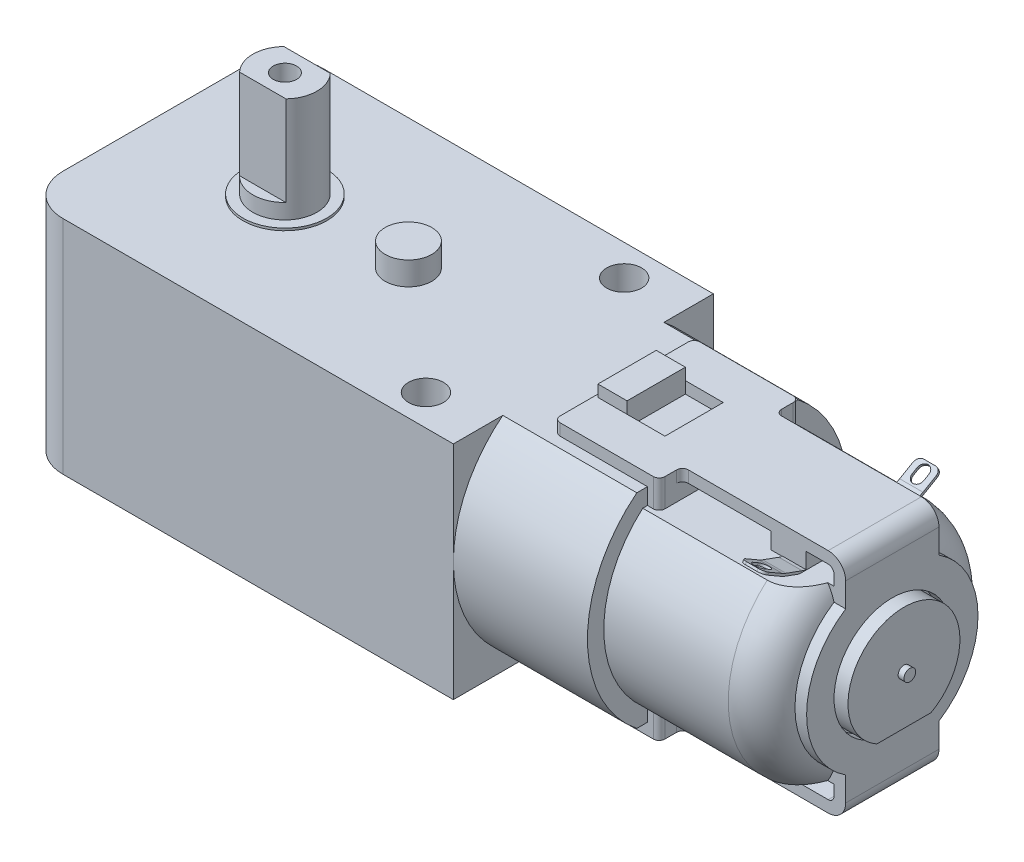
from build123d import *
from build123d.topology import SkipClean

# Parameters (mm, degrees)
SKETCH_1_W             = 37
SKETCH_1_H             = 22.3
EXTRUDE_1_DEPTH        = 9.5
EXTRUDE_2_DEPTH        = 11.5
EXTRUDE_3_DEPTH        = 14
EXTRUDE_4_DEPTH        = 2
SKETCH_5_R             = 0.5
EXTRUDE_5_DEPTH        = 0.5
SKETCH_6_R             = 7.35
SKETCH_6_R_2           = 5
SKETCH_6_W             = 8
SKETCH_6_H             = 3.583761276
EXTRUDE_6_DEPTH        = 1
SKETCH_7_W             = 8
SKETCH_7_H             = 1
EXTRUDE_7_DEPTH        = 23
EXTRUDE_START          = -1
SKETCH_8_W             = 9
SKETCH_8_H             = 2
EXTRUDE_8_DEPTH        = 1
SKETCH_9_W             = 4
SKETCH_9_H             = 5
CUT_EXTRUDE_1_DEPTH    = 1
SKETCH_10_W            = 0.75
SKETCH_10_H            = 1
EXTRUDE_9_DEPTH        = 2.5
SKETCH_11_R            = 1.5
CUT_EXTRUDE_2_DEPTH    = 52.454567339
SKETCH_12_W            = 3
SKETCH_12_H            = 8
EXTRUDE_10_DEPTH       = 1.4
EXTRUDE_12_DEPTH       = 2
SKETCH_14_R            = 2
EXTRUDE_13_DEPTH       = 2
SKETCH_15_R            = 3.6
EXTRUDE_14_DEPTH       = 0.2
EXTRUDE_15_DEPTH       = 9
SKETCH_17_R            = 2.75
EXTRUDE_16_DEPTH       = 1.3
SKETCH_22_R            = 1
CUT_EXTRUDE_5_DEPTH    = 7
SKETCH_18_W            = 5
SKETCH_18_H            = 3
EXTRUDE_17_DEPTH       = 5
SKETCH_19_R            = 1.5
CUT_EXTRUDE_3_DEPTH    = 51.487746038
FILLET_1_R             = 3.5
FILLET_2_R             = 3.5
FILLET_3_R             = 0.5
FILLET_4_R             = 1.5
CUT_EXTRUDE_4_DEPTH    = 51.609625012
FILLET_5_R             = 0.5
MIRROR_START           = -2.5
MIRROR_3_OUTLINE_W     = 3.25
MIRROR_3_OUTLINE_H     = 1
MIRROR_3_DEPTH         = 5
MIRROR_START_2         = -6
MIRROR_3_2_OUTLINE_W   = 1
MIRROR_3_2_OUTLINE_H   = 1.4
MIRROR_3_2_OUTLINE_W_2 = 2.75
MIRROR_3_2_OUTLINE_H_2 = 1
MIRROR_3_2_DEPTH       = 12
MIRROR_3_3_OUTLINE_W   = 2.5
MIRROR_3_3_OUTLINE_H   = 1
MIRROR_3_3_DEPTH       = 5
MIRROR_3_4_OUTLINE_W   = 3.25
MIRROR_3_4_OUTLINE_H   = 1
MIRROR_3_4_DEPTH       = 2
MIRROR_START_3         = 4
MIRROR_3_5_OUTLINE_W   = 3.25
MIRROR_3_5_OUTLINE_H   = 1
MIRROR_3_5_DEPTH       = 2
FILLET_6_R             = 1
FILLET_7_R             = 0.5


with BuildPart() as part:
    # 草图1 → 凸台-拉伸1 (new, symmetric)
    with BuildSketch(Plane(origin=(0, 0, 0), x_dir=(1, 0, 0), z_dir=(0, 1, 0))):
        Rectangle(SKETCH_1_W, SKETCH_1_H)
    extrude(amount=EXTRUDE_1_DEPTH, both=True)

    # 草图2 → 凸台-拉伸2 (add)
    with BuildSketch(Plane(origin=(18.5, 0, 0), x_dir=(0, 0, -1), z_dir=(1, 0, 0))):
        with BuildLine():
            Line((-6.910861017, -8), (6.910861017, -8))
            ThreePointArc((6.910861017, -8), (11.15, 0.75), (6.910861017, 9.5))
            Line((6.910861017, 9.5), (-6.910861017, 9.5))
            ThreePointArc((-6.910861017, 9.5), (-11.15, 0.75), (-6.910861017, -8))
        make_face()
    extrude(amount=EXTRUDE_2_DEPTH)

    # 草图3 → 凸台-拉伸3 (add)
    with BuildSketch(Plane(origin=(30, 0, 0), x_dir=(0, 0, -1), z_dir=(1, 0, 0))):
        with BuildLine():
            Line((6.406246951, 8.1), (-6.406246951, 8.1))
            ThreePointArc((-6.406246951, 8.1), (-9.75, 0.75), (-6.406246951, -6.6))
            Line((-6.406246951, -6.6), (6.406246951, -6.6))
            ThreePointArc((6.406246951, -6.6), (9.75, 0.75), (6.406246951, 8.1))
        make_face()
    extrude(amount=EXTRUDE_3_DEPTH)

    # 草图4 → 凸台-拉伸4 (add)
    with BuildSketch(Plane(origin=(44, 0, 0), x_dir=(0, 0, -1), z_dir=(1, 0, 0))):
        with BuildLine():
            Line((-2.323790008, -3.45), (2.323790008, -3.45))
            ThreePointArc((2.323790008, -3.45), (0, 5.55), (-2.323790008, -3.45))
        make_face()
    extrude(amount=EXTRUDE_4_DEPTH)

    # 草图5 → 凸台-拉伸5 (add)
    with BuildSketch(Plane(origin=(46, 0, 0), x_dir=(0, 0, -1), z_dir=(1, 0, 0))):
        with Locations((0, 0.75)):
            Circle(SKETCH_5_R)
    extrude(amount=EXTRUDE_5_DEPTH)

    # 草图6 → 凸台-拉伸6 (add)
    # profile 1 of 3: a face of its own
    with BuildSketch(Plane(origin=(44, 0, 0), x_dir=(0, 0, -1), z_dir=(1, 0, 0))):
        with Locations((0, 0.75)):
            Circle(SKETCH_6_R)
        with Locations((0, 0.75)):
            Circle(SKETCH_6_R_2, mode=Mode.SUBTRACT)
    # profile 2 of 3: a face of its own
    with BuildSketch(Plane(origin=(44, 0, 0), x_dir=(0, 0, -1), z_dir=(1, 0, 0))):
        with Locations((0, 8.708119362)):
            Rectangle(SKETCH_6_W, SKETCH_6_H)
    # profile 3 of 3: a face of its own
    with BuildSketch(Plane(origin=(44, 0, 0), x_dir=(0, 0, -1), z_dir=(1, 0, 0))):
        with Locations((0, -7.208119362)):
            Rectangle(SKETCH_6_W, SKETCH_6_H)
    extrude(amount=EXTRUDE_6_DEPTH)

    # 草图7 → 凸台-拉伸7 (add)
    with BuildSketch(Plane(origin=(45, 0, 0), x_dir=(0, 0, -1), z_dir=(1, 0, 0))):
        with Locations((0, 10)):
            Rectangle(SKETCH_7_W, SKETCH_7_H)
        with Locations((0, -8.5)):
            Rectangle(SKETCH_7_W, SKETCH_7_H)
    extrude(amount=-EXTRUDE_7_DEPTH)

    # 草图8 → 凸台-拉伸8 (add)
    with BuildSketch(Plane(origin=(0, 10.5, 0), x_dir=(1, 0, 0), z_dir=(0, 1, 0)).offset(EXTRUDE_START)):
        with Locations((26.5, -5)):
            Rectangle(SKETCH_8_W, SKETCH_8_H)
        with Locations((26.5, 5)):
            Rectangle(SKETCH_8_W, SKETCH_8_H)
    extrude(amount=EXTRUDE_8_DEPTH)

    # 草图9 → 切除-拉伸1 (cut)
    with BuildSketch(Plane(origin=(0, 10.5, 0), x_dir=(1, 0, 0), z_dir=(0, 1, 0))):
        with Locations((26, 0)):
            Rectangle(SKETCH_9_W, SKETCH_9_H)
    extrude(amount=-CUT_EXTRUDE_1_DEPTH, mode=Mode.SUBTRACT)

    # 草图10 → 凸台-拉伸9 (add, symmetric)
    with BuildSketch(Plane.XY):
        Polygon((24.75, 11.5), (22.25, 11.5), (22.25, 10.5), (24, 10.5), (24.75, 10.5), align=None)
        with Locations((24.375, 10)):
            Rectangle(SKETCH_10_W, SKETCH_10_H)
    extrude(amount=EXTRUDE_9_DEPTH, both=True)

    # 草图11 → 切除-拉伸2 (cut, through all)
    with BuildSketch(Plane(origin=(0, 9.5, 0), x_dir=(1, 0, 0), z_dir=(0, 1, 0))):
        with Locations(Location((13.5, 8.5, 0), (0, 0, 270))):
            Circle(SKETCH_11_R)
        with Locations(Location((13.5, -8.5, 0), (0, 0, 90))):
            Circle(SKETCH_11_R)
    extrude(amount=-CUT_EXTRUDE_2_DEPTH, mode=Mode.SUBTRACT)

    # 草图12 → 凸台-拉伸10 (add)
    with BuildSketch(Plane(origin=(0, 8.1, 0), x_dir=(1, 0, 0), z_dir=(0, 1, 0))):
        with Locations((40.1, 0)):
            Rectangle(SKETCH_12_W, SKETCH_12_H)
    extrude(amount=EXTRUDE_10_DEPTH)

    # 草图13 → 凸台-拉伸12 (add)
    with BuildSketch(Plane(origin=(41.6, 0, 0), x_dir=(0, 0, -1), z_dir=(1, 0, 0))):
        with BuildLine():
            Line((-3.647346039, 8.1), (3.647346039, 8.1))
            ThreePointArc((3.647346039, 8.1), (3.994642394, 8.130384494), (4.331386325, 8.220614758))
            Line((4.331386325, 8.220614758), (5.714960339, 8.724194516))
            ThreePointArc((5.714960339, 8.724194516), (5.876156575, 8.790964184), (6.030920052, 8.87152895))
            Line((6.030920052, 8.87152895), (7.611436049, 9.784040287))
            Line((7.611436049, 9.784040287), (7.711436049, 9.610835206))
            Line((7.711436049, 9.610835206), (6.130920052, 8.698323869))
            ThreePointArc((6.130920052, 8.698323869), (5.960680228, 8.609702626), (5.783364367, 8.536255992))
            Line((5.783364367, 8.536255992), (4.399790354, 8.032676234))
            ThreePointArc((4.399790354, 8.032676234), (4.029372029, 7.933422943), (3.647346039, 7.9))
            Line((3.647346039, 7.9), (-3.647346039, 7.9))
            ThreePointArc((-3.647346039, 7.9), (-4.029372029, 7.933422943), (-4.399790354, 8.032676234))
            Line((-4.399790354, 8.032676234), (-5.783364367, 8.536255992))
            ThreePointArc((-5.783364367, 8.536255992), (-5.960680228, 8.609702626), (-6.130920052, 8.698323869))
            Line((-6.130920052, 8.698323869), (-7.711436049, 9.610835206))
            Line((-7.711436049, 9.610835206), (-7.611436049, 9.784040287))
            Line((-7.611436049, 9.784040287), (-6.030920052, 8.87152895))
            ThreePointArc((-6.030920052, 8.87152895), (-5.876156575, 8.790964184), (-5.714960339, 8.724194516))
            Line((-5.714960339, 8.724194516), (-4.331386325, 8.220614758))
            ThreePointArc((-4.331386325, 8.220614758), (-3.994642394, 8.130384494), (-3.647346039, 8.1))
        make_face()
    extrude(amount=-EXTRUDE_12_DEPTH)

    # 草图14 → 凸台-拉伸13 (add)
    with BuildSketch(Plane(origin=(0, 9.5, 0), x_dir=(1, 0, 0), z_dir=(0, 1, 0))):
        with Locations(Location((3.5, 0, 0), (0, 0, 270))):
            Circle(SKETCH_14_R)
    extrude(amount=EXTRUDE_13_DEPTH)

    # 草图15 → 凸台-拉伸14 (add)
    with BuildSketch(Plane(origin=(0, 9.5, 0), x_dir=(1, 0, 0), z_dir=(0, 1, 0))):
        with Locations(Location((-7.1, 0, 0), (0, 0, 270))):
            Circle(SKETCH_15_R)
    extrude_14 = extrude(amount=EXTRUDE_14_DEPTH)

    # 草图16 → 凸台-拉伸15 (add)
    with BuildSketch(Plane(origin=(0, 9.7, 0), x_dir=(1, 0, 0), z_dir=(0, 1, 0))):
        with BuildLine():
            Line((-9.088089535, 1.9), (-5.111910465, 1.9))
            ThreePointArc((-5.111910465, 1.9), (-4.35, 0), (-5.111910465, -1.9))
            Line((-5.111910465, -1.9), (-9.088089535, -1.9))
            ThreePointArc((-9.088089535, -1.9), (-9.85, 0), (-9.088089535, 1.9))
        make_face()
    extrude_15 = extrude(amount=EXTRUDE_15_DEPTH)

    # 草图17 → 凸台-拉伸16 (add)
    with SkipClean():  # the faces are left unmerged after this step: merging them gives an invalid solid
        with BuildSketch(Plane(origin=(0, 9.7, 0), x_dir=(1, 0, 0), z_dir=(0, 1, 0))):
            with Locations(Location((-7.1, 0, 0), (0, 0, 43.702114437))):
                Circle(SKETCH_17_R)
        extrude_16 = extrude(amount=EXTRUDE_16_DEPTH)

    # 草图22 → 切除-拉伸5 (cut)
    with SkipClean():  # the faces are left unmerged after this step: merging them gives an invalid solid
        with BuildSketch(Plane(origin=(0, 18.7, 0), x_dir=(1, 0, 0), z_dir=(0, 1, 0))):
            with Locations(Location((-7.1, 0, 0), (0, 0, 270))):
                Circle(SKETCH_22_R)
        cut_extrude_5 = extrude(amount=-CUT_EXTRUDE_5_DEPTH, mode=Mode.SUBTRACT)

    # 草图18 → 凸台-拉伸17 (add)
    with SkipClean():  # the faces are left unmerged after this step: merging them gives an invalid solid
        with BuildSketch(Plane.ZY.offset(18.5)):
            with Locations((0, 1)):
                Rectangle(SKETCH_18_W, SKETCH_18_H)
        extrude(amount=EXTRUDE_17_DEPTH)

    # 草图19 → 切除-拉伸3 (cut, through all)
    with SkipClean():  # the faces are left unmerged after this step: merging them gives an invalid solid
        with BuildSketch(Plane(origin=(0, 2.5, 0), x_dir=(1, 0, 0), z_dir=(0, 1, 0))):
            with Locations(Location((-21, 0, 0), (0, 0, 270))):
                Circle(SKETCH_19_R)
        extrude(amount=-CUT_EXTRUDE_3_DEPTH, mode=Mode.SUBTRACT)

    # 圆角1
    fillet_1_edges = [part.edges().sort_by_distance(p)[0] for p in [
        (-18.5, 0, -11.15),
        (-18.5, 0, 11.15),
    ]]
    fillet(fillet_1_edges, radius=FILLET_1_R)

    # 圆角2
    # the kernel refuses this fillet: 3.5 mm, written as the material it takes off along each edge
    with BuildSketch(Plane(origin=(44, 0.75, 0), x_dir=(0, -0.9908385176498127, 0.13505196015431215), z_dir=(0, 0.13505196015431215, 0.9908385176498127))) as fillet_2_piece_1_section:
        with BuildLine():
            CenterArc((6.25, -3.322649545), FILLET_2_R, 0, 71.682301589)
            Line((7.35, 0), (9.75, 0))
            Line((9.75, 0), (9.75, -3.322649545))
        make_face()
    fillet_2_piece_1 = revolve(axis=Axis((44, 0.75, 0), (1, 0, 0)), revolution_arc=195.523249004, mode=Mode.PRIVATE)
    fillet_2_piece_1 = split(fillet_2_piece_1, bisect_by=Plane(origin=(44, 0.75, -4), z_dir=(0, 0, -1)), keep=Keep.TOP, mode=Mode.PRIVATE)
    fillet_2_piece_1 = split(fillet_2_piece_1, bisect_by=Plane(origin=(44, 8.1, 0), z_dir=(0, -1, 0)), keep=Keep.TOP, mode=Mode.PRIVATE)
    add(fillet_2_piece_1, mode=Mode.SUBTRACT)
    with BuildSketch(Plane(origin=(44, 0.75, 0), x_dir=(0, 0.9908385176498129, -0.13505196015431062), z_dir=(0, -0.13505196015431062, -0.9908385176498129))) as fillet_2_piece_2_section:
        with BuildLine():
            CenterArc((6.25, -3.322649545), FILLET_2_R, 0, 71.682301589)
            Line((7.35, 0), (9.75, 0))
            Line((9.75, 0), (9.75, -3.322649545))
        make_face()
    fillet_2_piece_2 = revolve(axis=Axis((44, 0.75, 0), (1, 0, 0)), revolution_arc=195.523249004, mode=Mode.PRIVATE)
    fillet_2_piece_2 = split(fillet_2_piece_2, bisect_by=Plane(origin=(44, 0.75, 4), z_dir=(0, 0, 1)), keep=Keep.TOP, mode=Mode.PRIVATE)
    fillet_2_piece_2 = split(fillet_2_piece_2, bisect_by=Plane(origin=(44, 8.1, 0), z_dir=(0, -1, 0)), keep=Keep.TOP, mode=Mode.PRIVATE)
    add(fillet_2_piece_2, mode=Mode.SUBTRACT)

    # 圆角3
    fillet_3_edges = [part.edges().sort_by_distance(p)[0] for p in [
        (44, 9.5, 0),
        (44, -8, 0),
    ]]
    fillet(fillet_3_edges, radius=FILLET_3_R)

    # 圆角4
    fillet_4_edges = [part.edges().sort_by_distance(p)[0] for p in [
        (45, 10.5, 0),
        (45, -9, 0),
    ]]
    fillet(fillet_4_edges, radius=FILLET_4_R)

    # 草图20 → 切除-拉伸4 (cut, through all)
    with BuildSketch(Plane(origin=(0, 3.868976645, -2.233754708), x_dir=(1, 0, 0), z_dir=(0, -0.8660254037844384, 0.5000000000000007))):
        with BuildLine():
            Line((41.1, 10.821205785), (41.1, 10.321205785))
            ThreePointArc((41.1, 10.321205785), (40.6, 9.821205785), (40.1, 10.321205785))
            Line((40.1, 10.321205785), (40.1, 10.821205785))
            ThreePointArc((40.1, 10.821205785), (40.6, 11.321205785), (41.1, 10.821205785))
        make_face()
    cut_extrude_4 = extrude(amount=-CUT_EXTRUDE_4_DEPTH, mode=Mode.SUBTRACT)

    # 圆角5
    fillet_5_edges = [part.edges().sort_by_distance(p)[0] for p in [
        (41.6, 9.697437746, -7.661436049),
        (41.6, 9.697437746, 7.661436049),
        (39.6, 9.697437746, -7.661436049),
        (39.6, 9.697437746, 7.661436049),
    ]]
    fillet(fillet_5_edges, radius=FILLET_5_R)

    # 镜向2: 切除-拉伸4 across plane
    add(cut_extrude_4.mirror(Plane.XY), mode=Mode.SUBTRACT)

    # 镜向3: read off the stored shape, not the designer's step
    # 镜向3 outline → 镜向3 (cut)
    with BuildSketch(Plane.XY.offset(MIRROR_START)):
        with Locations((26.375, -8.5)):
            Rectangle(MIRROR_3_OUTLINE_W, MIRROR_3_OUTLINE_H)
    extrude(amount=MIRROR_3_DEPTH, mode=Mode.SUBTRACT)

    # Mirror 3 2 outline → Mirror 3 2 (add)
    with BuildSketch(Plane.XY.offset(MIRROR_START_2)):
        with Locations((30.5, 8.8)):
            Rectangle(MIRROR_3_2_OUTLINE_W, MIRROR_3_2_OUTLINE_H)
        with Locations((23.375, -8.5)):
            Rectangle(MIRROR_3_2_OUTLINE_W_2, MIRROR_3_2_OUTLINE_H_2)
        Polygon((30, -8), (28, -8), (28, -9), (31, -9), (31, -6.6), (30, -6.6), align=None)
    extrude(amount=MIRROR_3_2_DEPTH)

    # Mirror 3 3 outline → Mirror 3 3 (add)
    with BuildSketch(Plane.XY.offset(MIRROR_START)):
        with Locations((23.5, -9.5)):
            Rectangle(MIRROR_3_3_OUTLINE_W, MIRROR_3_3_OUTLINE_H)
    extrude(amount=MIRROR_3_3_DEPTH)

    # Mirror 3 4 outline → Mirror 3 4 (add)
    with BuildSketch(Plane.XY.offset(MIRROR_START_2)):
        with Locations((26.375, -8.5)):
            Rectangle(MIRROR_3_4_OUTLINE_W, MIRROR_3_4_OUTLINE_H)
    extrude(amount=MIRROR_3_4_DEPTH)

    # Mirror 3 5 outline → Mirror 3 5 (add)
    with BuildSketch(Plane.XY.offset(MIRROR_START_3)):
        with Locations((26.375, -8.5)):
            Rectangle(MIRROR_3_5_OUTLINE_W, MIRROR_3_5_OUTLINE_H)
    extrude(amount=MIRROR_3_5_DEPTH)

    # 圆角6
    fillet_6_edges = [part.edges().sort_by_distance(p)[0] for p in [
        (-18.5, 1, 2.5),
        (-18.5, 1, -2.5),
    ]]
    fillet(fillet_6_edges, radius=FILLET_6_R)

    # 圆角7
    fillet_7_edges = [part.edges().sort_by_distance(p)[0] for p in [
        (22, 10, 6),
        (31, 10, 4),
        (22, 10, -6),
        (31, 10, -4),
        (31, 9.3, -6),
        (31, 9.3, 6),
        (22, -8.5, 6),
        (31, -7.8, -6),
        (22, -8.5, -6),
        (31, -7.8, 6),
        (31, -8.5, -4),
        (31, -8.5, 4),
    ]]
    fillet(fillet_7_edges, radius=FILLET_7_R)

    # 镜向5: 凸台-拉伸14, 凸台-拉伸15, 凸台-拉伸16, 切除-拉伸5 across plane
    add(extrude_14.mirror(Plane.ZX))
    add(extrude_15.mirror(Plane.ZX))
    add(extrude_16.mirror(Plane.ZX))
    add(cut_extrude_5.mirror(Plane.ZX), mode=Mode.SUBTRACT)


solid = part.part
